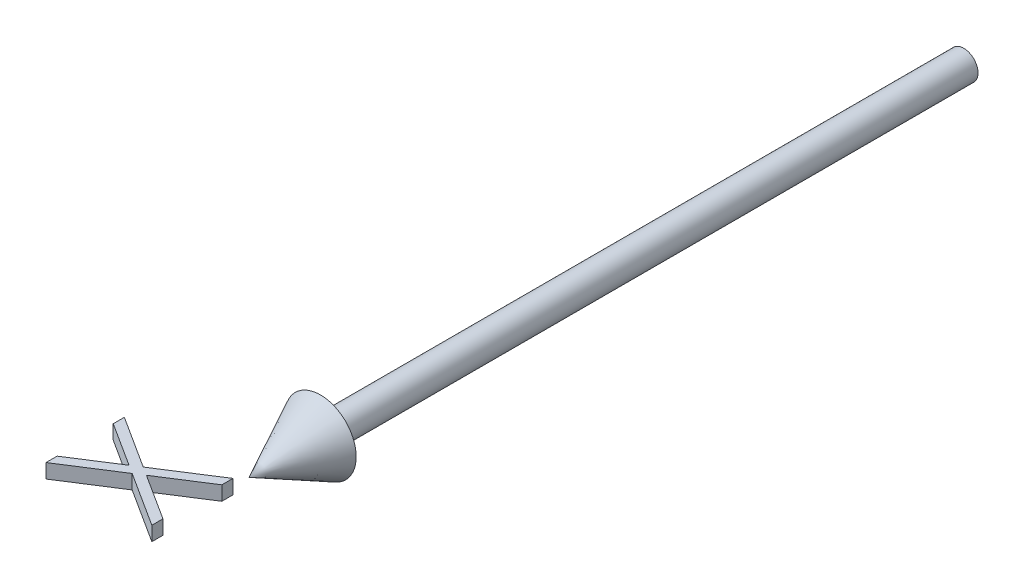
from build123d import *

# Parameters (mm, degrees)
BOSS_EXTRUDE1_DEPTH      = 1
BOSS_EXTRUDE1_DEPTH_BACK = 1


with BuildPart() as part:
    # Sketch2 → Revolve1 (revolve)
    with BuildSketch(Plane(origin=(0, 0, 0), x_dir=(1, 0, 0), z_dir=(0, 1, 0))):
        Polygon((0, -100), (5, -90), (2, -90), (2, 0), (0, 0), align=None)
    revolve(axis=Axis((0, 0, -41.949952025), (0, 0, 1)))


with BuildPart() as body_2:
    # Sketch3 → Boss-Extrude1 (new, two sides: drawn at the far end of the back side and taken through both)
    with BuildSketch(Plane(origin=(0, 0, 0), x_dir=(1, 0, 0), z_dir=(0, 1, 0)).offset(-BOSS_EXTRUDE1_DEPTH_BACK)):
        Polygon((-15, -102.435953252), (-15, -103.989438829), (-8.864182692, -107.916722483), (-15, -111.844006137), (-15, -113.397491713), (-7.650240385, -108.694967675), (0, -113.589799406), (0, -112.036313829), (-6.436298077, -107.916722483), (0, -103.797131137), (0, -102.24364556), (-7.650240385, -107.141482098), align=None)
    extrude(amount=BOSS_EXTRUDE1_DEPTH + BOSS_EXTRUDE1_DEPTH_BACK)


solid = Compound([part.part, body_2.part])
